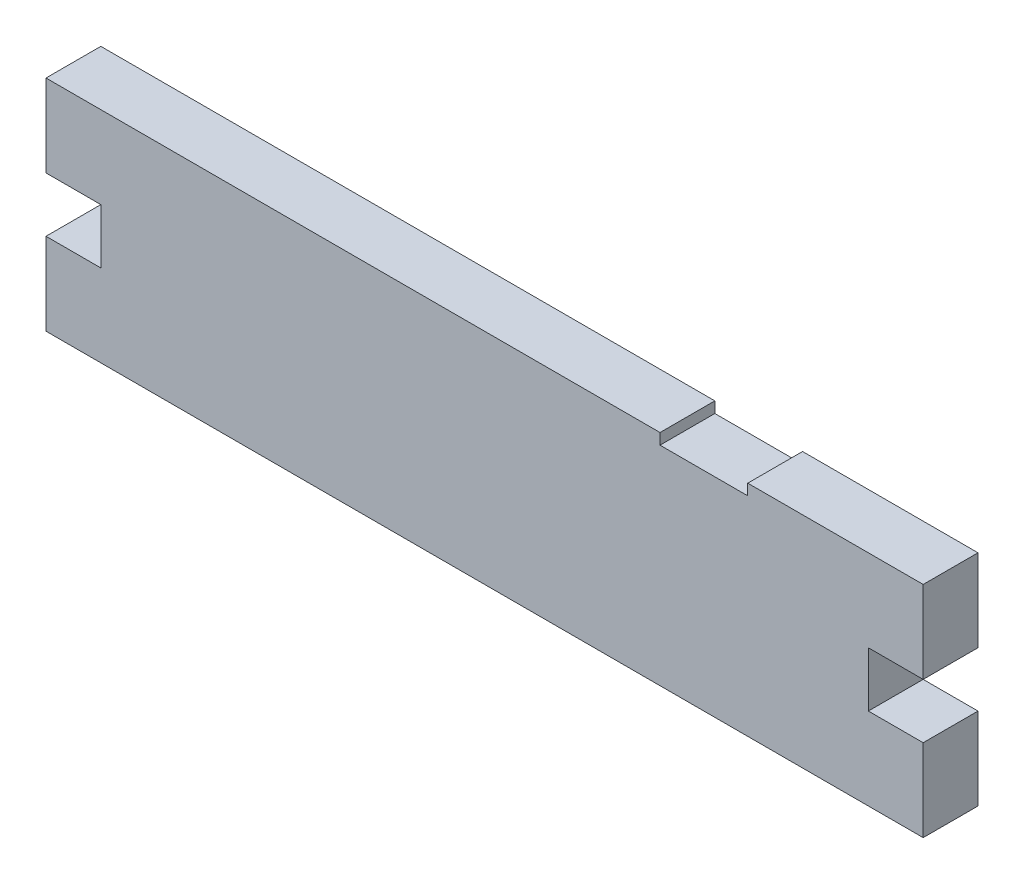
from build123d import *

# Parameters (mm, degrees)
BOSS_EXTRU_1_DEPTH = 5


with BuildPart() as part:
    # Esquisse1 → Boss.-Extru.1 (new body)
    with BuildSketch(Plane.XY):
        Polygon((0, 0), (70, 0), (75, 0), (75, 7.5), (70, 7.5), (70, 12.5), (75, 12.5), (75, 20), (70, 20), (59, 20), (59, 19), (51, 19), (51, 20), (0, 20), (-5, 20), (-5, 12.5), (0, 12.5), (0, 7.5), (-5, 7.5), (-5, 0), align=None)
    extrude(amount=BOSS_EXTRU_1_DEPTH)


solid = part.part
